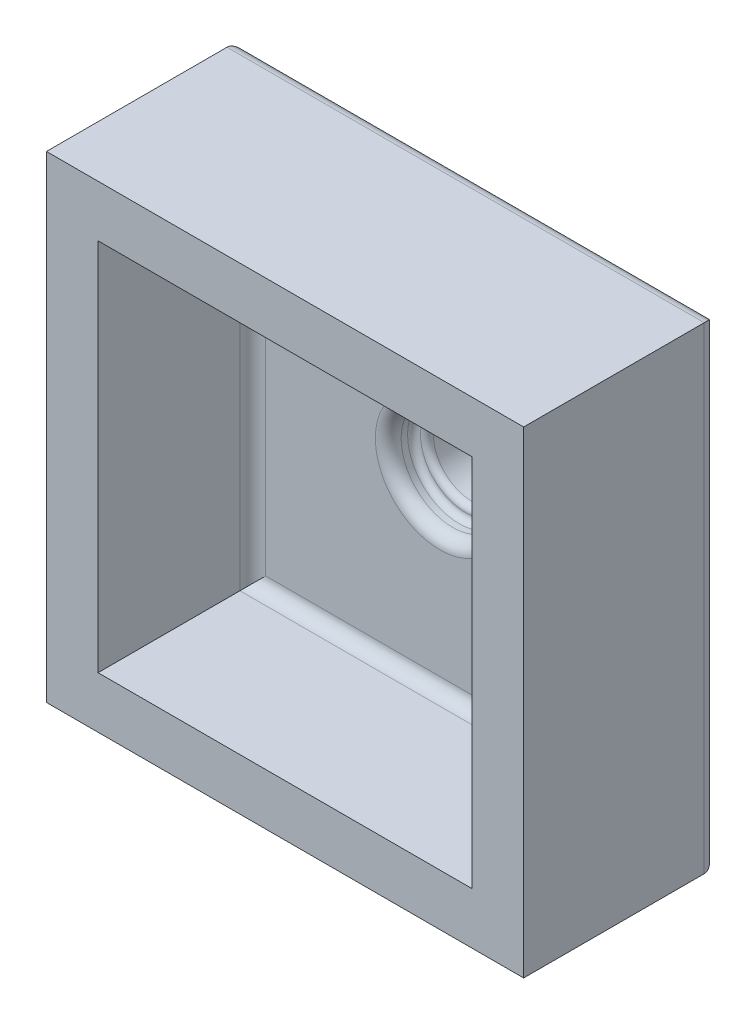
from build123d import *

# Parameters (mm, degrees)
SKETCH2_W           = 37
SKETCH2_H           = 37
BOSS_EXTRUDE1_DEPTH = 15
SKETCH3_W           = 29
SKETCH3_H           = 29
CUT_EXTRUDE1_DEPTH  = 12
SKETCH4_R           = 4
CUT_EXTRUDE2_DEPTH  = 12
BOSS_EXTRUDE3_START = 12
SKETCH5_R           = 4
BOSS_EXTRUDE3_DEPTH = 12
SKETCH6_R           = 3
CUT_EXTRUDE3_DEPTH  = 12
FILLET3_R           = 1
FILLET4_R           = 1
FILLET6_R           = 0.5


with BuildPart() as part:
    # Sketch2 → Boss-Extrude1 (new body)
    with BuildSketch(Plane.XY):
        Rectangle(SKETCH2_W, SKETCH2_H)
    extrude(amount=BOSS_EXTRUDE1_DEPTH)

    # Sketch3 → Cut-Extrude1 (cut)
    with BuildSketch(Plane.XY.offset(15)):
        Rectangle(SKETCH3_W, SKETCH3_H)
    extrude(amount=-CUT_EXTRUDE1_DEPTH, mode=Mode.SUBTRACT)

    # Sketch4 → Cut-Extrude2 (cut)
    with BuildSketch(Plane(origin=(0, 0, 0), x_dir=(-1, 0, 0), z_dir=(0, 0, -1))):
        Circle(SKETCH4_R)
    extrude(amount=-CUT_EXTRUDE2_DEPTH, mode=Mode.SUBTRACT)

    # Sketch5 → Boss-Extrude3 (add)
    with BuildSketch(Plane(origin=(0, 0, 1), x_dir=(-1, 0, 0), z_dir=(0, 0, -1)).offset(BOSS_EXTRUDE3_START)):
        Circle(SKETCH5_R)
    extrude(amount=-BOSS_EXTRUDE3_DEPTH)

    # Sketch6 → Cut-Extrude3 (cut)
    with BuildSketch(Plane(origin=(0, 0, -11), x_dir=(-1, 0, 0), z_dir=(0, 0, -1))):
        Circle(SKETCH6_R)
    extrude(amount=-CUT_EXTRUDE3_DEPTH, mode=Mode.SUBTRACT)

    # Fillet3
    fillet3_edges = [part.edges().sort_by_distance(p)[0] for p in [
        (4, 0, 0),
        (0, 18.5, 0),
        (18.5, 0, 0),
        (0, -18.5, 0),
        (-18.5, 0, 0),
    ]]
    fillet(fillet3_edges, radius=FILLET3_R)

    # Fillet4
    fillet4_edges = [part.edges().sort_by_distance(p)[0] for p in [
        (-14.5, 0, 3),
        (0, 14.5, 3),
        (14.5, 0, 3),
        (0, -14.5, 3),
        (4, 0, 3),
    ]]
    fillet(fillet4_edges, radius=FILLET4_R)

    # Fillet6
    fillet6_edges = [part.edges().sort_by_distance(p)[0] for p in [
        (4, 0, 1),
        (3, 0, 1),
    ]]
    fillet(fillet6_edges, radius=FILLET6_R - 0.0001)  # a hair under: the kernel refuses the full size


solid = part.part
